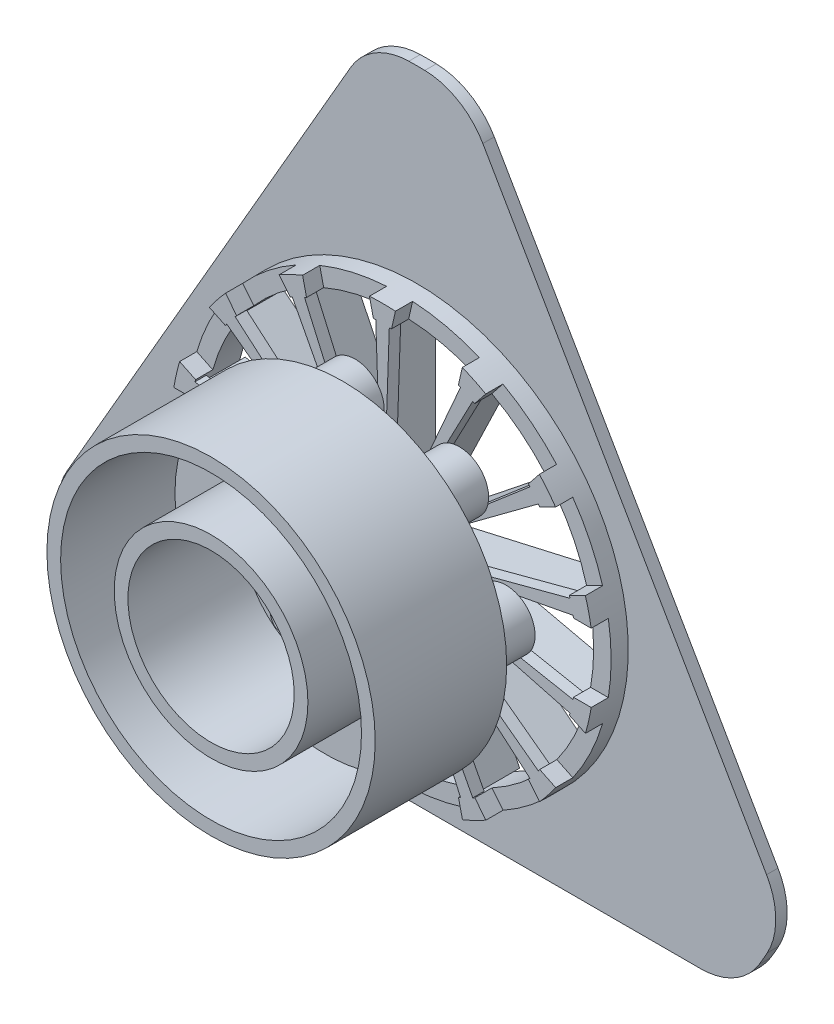
from build123d import *

# Parameters (mm, degrees)
SKETCH2_R               = 18.5
BOSS_EXTRUDE10_DEPTH    = 4
SKETCH8_R               = 22.678479032
SKETCH8_R_2             = 21.249376386
BOSS_EXTRUDE11_DEPTH    = 4
SKETCH9_R               = 1.624259049
SKETCH9_R_2             = 1.124259049
SKETCH9_R_3             = 2.552274029
SKETCH9_R_4             = 2.052274029
BOSS_EXTRUDE12_DEPTH    = 5
BOSS_EXTRUDE16_START    = -1.5
SKETCH11_R              = 14.361292765
SKETCH11_R_2            = 8.114913008
SKETCH11_R_3            = 2.552274029
SKETCH11_R_4            = 4.894571286
SKETCH11_R_5            = 2.052274029
BOSS_EXTRUDE16_DEPTH    = 1.5
SKETCH12_R              = 14.361292765
SKETCH12_R_2            = 13.161292765
SKETCH12_R_3            = 8.473676317
SKETCH12_R_4            = 7.273676317
BOSS_EXTRUDE14_DEPTH    = 10
SKETCH13_R              = 0.9
CUT_EXTRUDE2_DEPTH      = 1.5
BOSS_EXTRUDE17_START    = -3
BOSS_EXTRUDE17_DEPTH    = 1
CUT_EXTRUDE4_START      = -2
SKETCH17_W              = 1.972139385
SKETCH17_H              = 6
CUT_EXTRUDE4_DEPTH      = 5
CIRPATTERN1_COUNT       = 14
CUT_EXTRUDE5_DEPTH      = 34.595041634
CUT_EXTRUDE5_DEPTH_BACK = 34.595041634
SKETCH18_R              = 22.678479032
SKETCH18_R_2            = 21.249376386
SKETCH19_R              = 22.100164657
SKETCH19_R_2            = 18.5
BOSS_EXTRUDE18_DEPTH    = 1
BOSS_EXTRUDE2_START     = -1
SKETCH3_R               = 35
SKETCH3_R_2             = 22.100164657
BOSS_EXTRUDE2_DEPTH     = 1
SKETCH4_R               = 2.9
BOSS_EXTRUDE3_DEPTH     = 2
SKETCH6_R               = 5
BOSS_EXTRUDE4_DEPTH     = 1
SKETCH7_R               = 59.131365533
CUT_EXTRUDE1_DEPTH      = 10
FILLET1_R               = 6
BOSS_EXTRUDE19_START    = -0.5
BOSS_EXTRUDE19_DEPTH    = 0.5


with BuildPart() as part:
    # Sketch2 → Boss-Extrude10 (new body)
    with BuildSketch(Plane.XY.offset(10)):
        Circle(SKETCH2_R)
        with BuildLine():
            Line((-0.15, 16.969746557), (-0.15, 0.683739717))
            ThreePointArc((-0.15, 0.683739717), (-0.155764654, 0.682449539), (-0.161518215, 0.681110759))
            Line((-0.161518215, 0.681110759), (-7.227751758, 15.354295905))
            ThreePointArc((-7.227751758, 15.354295905), (-3.776271369, 16.544925891), (-0.15, 16.969746557))
        make_face(mode=Mode.SUBTRACT)
        with BuildLine():
            Line((-7.498042418, 15.224130783), (-0.431808875, 0.550945638))
            ThreePointArc((-0.431808875, 0.550945638), (-0.436442861, 0.547282038), (-0.441045766, 0.543579463))
            Line((-0.441045766, 0.543579463), (-13.173958637, 10.697738641))
            ThreePointArc((-13.173958637, 10.697738641), (-10.580877249, 13.268000408), (-7.498042418, 15.224130783))
        make_face(mode=Mode.SUBTRACT)
        with BuildLine():
            Line((-13.361005578, 10.463189196), (-0.628092706, 0.309030018))
            ThreePointArc((-0.628092706, 0.309030018), (-0.630678208, 0.303718617), (-0.633218794, 0.298385587))
            Line((-0.633218794, 0.298385587), (-16.510901441, 3.92236304))
            ThreePointArc((-16.510901441, 3.92236304), (-15.289810625, 7.363184723), (-13.361005578, 10.463189196))
        make_face(mode=Mode.SUBTRACT)
        with BuildLine():
            Line((-16.577657721, 3.629884666), (-0.699975074, 0.005907213))
            ThreePointArc((-0.699975074, 0.005907213), (-0.7, 0), (-0.699975074, -0.005907213))
            Line((-0.699975074, -0.005907213), (-16.577657721, -3.629884666))
            ThreePointArc((-16.577657721, -3.629884666), (-16.970409488, 0), (-16.577657721, 3.629884666))
        make_face(mode=Mode.SUBTRACT)
        with BuildLine():
            Line((-16.510901441, -3.92236304), (-0.633218794, -0.298385587))
            ThreePointArc((-0.633218794, -0.298385587), (-0.630678208, -0.303718617), (-0.628092706, -0.309030018))
            Line((-0.628092706, -0.309030018), (-13.361005578, -10.463189196))
            ThreePointArc((-13.361005578, -10.463189196), (-15.289810625, -7.363184723), (-16.510901441, -3.92236304))
        make_face(mode=Mode.SUBTRACT)
        with BuildLine():
            Line((-13.173958637, -10.697738641), (-0.441045766, -0.543579463))
            ThreePointArc((-0.441045766, -0.543579463), (-0.436442861, -0.547282038), (-0.431808875, -0.550945638))
            Line((-0.431808875, -0.550945638), (-7.498042418, -15.224130783))
            ThreePointArc((-7.498042418, -15.224130783), (-10.580877249, -13.268000408), (-13.173958637, -10.697738641))
        make_face(mode=Mode.SUBTRACT)
        with BuildLine():
            Line((-7.227751758, -15.354295905), (-0.161518215, -0.681110759))
            ThreePointArc((-0.161518215, -0.681110759), (-0.155764654, -0.682449539), (-0.15, -0.683739717))
            Line((-0.15, -0.683739717), (-0.15, -16.969746557))
            ThreePointArc((-0.15, -16.969746557), (-3.776271369, -16.544925891), (-7.227751758, -15.354295905))
        make_face(mode=Mode.SUBTRACT)
        with BuildLine():
            Line((0.15, -16.969746557), (0.15, -0.683739717))
            ThreePointArc((0.15, -0.683739717), (0.155764654, -0.682449539), (0.161518215, -0.681110759))
            Line((0.161518215, -0.681110759), (7.227751758, -15.354295905))
            ThreePointArc((7.227751758, -15.354295905), (3.776271369, -16.544925891), (0.15, -16.969746557))
        make_face(mode=Mode.SUBTRACT)
        with BuildLine():
            Line((7.498042418, -15.224130783), (0.431808875, -0.550945638))
            ThreePointArc((0.431808875, -0.550945638), (0.436442861, -0.547282038), (0.441045766, -0.543579463))
            Line((0.441045766, -0.543579463), (13.173958637, -10.697738641))
            ThreePointArc((13.173958637, -10.697738641), (10.580877249, -13.268000408), (7.498042418, -15.224130783))
        make_face(mode=Mode.SUBTRACT)
        with BuildLine():
            Line((13.361005578, -10.463189196), (0.628092706, -0.309030018))
            ThreePointArc((0.628092706, -0.309030018), (0.630678208, -0.303718617), (0.633218794, -0.298385587))
            Line((0.633218794, -0.298385587), (16.510901441, -3.92236304))
            ThreePointArc((16.510901441, -3.92236304), (15.289810625, -7.363184723), (13.361005578, -10.463189196))
        make_face(mode=Mode.SUBTRACT)
        with BuildLine():
            Line((16.577657721, -3.629884666), (0.699975074, -0.005907213))
            ThreePointArc((0.699975074, -0.005907213), (0.7, 0), (0.699975074, 0.005907213))
            Line((0.699975074, 0.005907213), (16.577657721, 3.629884666))
            ThreePointArc((16.577657721, 3.629884666), (16.970409488, 0), (16.577657721, -3.629884666))
        make_face(mode=Mode.SUBTRACT)
        with BuildLine():
            Line((16.510901441, 3.92236304), (0.633218794, 0.298385587))
            ThreePointArc((0.633218794, 0.298385587), (0.630678208, 0.303718617), (0.628092706, 0.309030018))
            Line((0.628092706, 0.309030018), (13.361005578, 10.463189196))
            ThreePointArc((13.361005578, 10.463189196), (15.289810625, 7.363184723), (16.510901441, 3.92236304))
        make_face(mode=Mode.SUBTRACT)
        with BuildLine():
            Line((13.173958637, 10.697738641), (0.441045766, 0.543579463))
            ThreePointArc((0.441045766, 0.543579463), (0.436442861, 0.547282038), (0.431808875, 0.550945638))
            Line((0.431808875, 0.550945638), (7.498042418, 15.224130783))
            ThreePointArc((7.498042418, 15.224130783), (10.580877249, 13.268000408), (13.173958637, 10.697738641))
        make_face(mode=Mode.SUBTRACT)
        with BuildLine():
            Line((7.227751758, 15.354295905), (0.161518215, 0.681110759))
            ThreePointArc((0.161518215, 0.681110759), (0.155764654, 0.682449539), (0.15, 0.683739717))
            Line((0.15, 0.683739717), (0.15, 16.969746557))
            ThreePointArc((0.15, 16.969746557), (3.776271369, 16.544925891), (7.227751758, 15.354295905))
        make_face(mode=Mode.SUBTRACT)
    extrude(amount=BOSS_EXTRUDE10_DEPTH)

    # Sketch9 → Boss-Extrude12 (add)
    # profile 1 of 14: a face of its own
    with BuildSketch(Plane.XY.offset(14)):
        with Locations(Location((1.474259049, 6.459150925, 0), (0, 0, 180))):
            Circle(SKETCH9_R)
        with Locations((1.474259049, 6.459150925)):
            Circle(SKETCH9_R_2, mode=Mode.SUBTRACT)
    # profile 2 of 14: a face of its own
    with BuildSketch(Plane.XY.offset(14)):
        with Locations(Location((6.731022253, 8.440434938, 0), (0, 0, 182.345436186))):
            Circle(SKETCH9_R_3)
        with Locations((6.731022253, 8.440434938)):
            Circle(SKETCH9_R_4, mode=Mode.SUBTRACT)
    # profile 3 of 14: a face of its own
    with BuildSketch(Plane.XY.offset(14)):
        with Locations((-2.402274029, 10.525050214)):
            Circle(SKETCH9_R_3)
        with Locations((-2.402274029, 10.525050214)):
            Circle(SKETCH9_R_4, mode=Mode.SUBTRACT)
    # profile 4 of 14: a face of its own
    with BuildSketch(Plane.XY.offset(14)):
        with Locations(Location((-4.130782061, 5.179836868, 0), (0, 0, 196.045646816))):
            Circle(SKETCH9_R)
        with Locations((-4.130782061, 5.179836868)):
            Circle(SKETCH9_R_2, mode=Mode.SUBTRACT)
    # profile 5 of 14: a face of its own
    with BuildSketch(Plane.XY.offset(14)):
        with Locations(Location((-9.72660897, 4.684088007, 0), (0, 0, 229.083135243))):
            Circle(SKETCH9_R_3)
        with Locations((-9.72660897, 4.684088007)):
            Circle(SKETCH9_R_4, mode=Mode.SUBTRACT)
    # profile 6 of 14: a face of its own
    with BuildSketch(Plane.XY.offset(14)):
        with Locations(Location((-6.625260026, 0, 0), (0, 0, 112.525781755))):
            Circle(SKETCH9_R)
        with Locations((-6.625260026, 0)):
            Circle(SKETCH9_R_2, mode=Mode.SUBTRACT)
    # profile 7 of 14: a face of its own
    with BuildSketch(Plane.XY.offset(14)):
        with Locations(Location((-9.72660897, -4.684088007, 0), (0, 0, 130.916864757))):
            Circle(SKETCH9_R_3)
        with Locations((-9.72660897, -4.684088007)):
            Circle(SKETCH9_R_4, mode=Mode.SUBTRACT)
    # profile 8 of 14: a face of its own
    with BuildSketch(Plane.XY.offset(14)):
        with Locations(Location((-4.130782061, -5.179836868, 0), (0, 0, 163.954353184))):
            Circle(SKETCH9_R)
        with Locations((-4.130782061, -5.179836868)):
            Circle(SKETCH9_R_2, mode=Mode.SUBTRACT)
    # profile 9 of 14: a face of its own
    with BuildSketch(Plane.XY.offset(14)):
        with Locations((-2.402274029, -10.525050214)):
            Circle(SKETCH9_R_3)
        with Locations((-2.402274029, -10.525050214)):
            Circle(SKETCH9_R_4, mode=Mode.SUBTRACT)
    # profile 10 of 14: a face of its own
    with BuildSketch(Plane.XY.offset(14)):
        with Locations(Location((6.731022253, -8.440434938, 0), (0, 0, 177.654563814))):
            Circle(SKETCH9_R_3)
        with Locations((6.731022253, -8.440434938)):
            Circle(SKETCH9_R_4, mode=Mode.SUBTRACT)
    # profile 11 of 14: a face of its own
    with BuildSketch(Plane.XY.offset(14)):
        with Locations(Location((5.969153026, -2.874592593, 0), (0, 0, 196.045646816))):
            Circle(SKETCH9_R)
        with Locations((5.969153026, -2.874592593)):
            Circle(SKETCH9_R_2, mode=Mode.SUBTRACT)
    # profile 12 of 14: a face of its own
    with BuildSketch(Plane.XY.offset(14)):
        with Locations(Location((1.474259049, -6.459150925, 0), (0, 0, 180))):
            Circle(SKETCH9_R)
        with Locations((1.474259049, -6.459150925)):
            Circle(SKETCH9_R_2, mode=Mode.SUBTRACT)
    # profile 13 of 14: a face of its own
    with BuildSketch(Plane.XY.offset(14)):
        with Locations(Location((5.969153026, 2.874592593, 0), (0, 0, 163.954353184))):
            Circle(SKETCH9_R)
        with Locations((5.969153026, 2.874592593)):
            Circle(SKETCH9_R_2, mode=Mode.SUBTRACT)
    # profile 14 of 14: a face of its own
    with BuildSketch(Plane.XY.offset(14)):
        with Locations(Location((10.795721491, 0, 0), (0, 0, 229.083135243))):
            Circle(SKETCH9_R_3)
        with Locations((10.795721491, 0)):
            Circle(SKETCH9_R_4, mode=Mode.SUBTRACT)
    extrude(amount=BOSS_EXTRUDE12_DEPTH)

    # Sketch11 → Boss-Extrude16 (add)
    # profile 1 of 4: a face of its own
    with BuildSketch(Plane.XY.offset(19).offset(BOSS_EXTRUDE16_START)):
        Circle(SKETCH11_R)
        Circle(SKETCH11_R_2, mode=Mode.SUBTRACT)
        with Locations(Location((10.795721491, 0, 0), (0, 0, 229.083135243))):
            Circle(SKETCH11_R_3, mode=Mode.SUBTRACT)
    # profile 2 of 4: a face of its own
    with BuildSketch(Plane.XY.offset(19).offset(BOSS_EXTRUDE16_START)):
        Circle(SKETCH11_R_2)
        Circle(SKETCH11_R_4, mode=Mode.SUBTRACT)
    # profile 3 of 4: a face of its own
    with BuildSketch(Plane.XY.offset(19).offset(BOSS_EXTRUDE16_START)):
        Circle(SKETCH11_R_4)
    # profile 4 of 4: a face of its own
    with BuildSketch(Plane.XY.offset(19).offset(BOSS_EXTRUDE16_START)):
        with Locations((10.795721491, 0)):
            Circle(SKETCH11_R_5)
    extrude(amount=BOSS_EXTRUDE16_DEPTH)

    # Sketch12 → Boss-Extrude14 (add)
    # profile 1 of 2: a face of its own
    with BuildSketch(Plane.XY.offset(19)):
        Circle(SKETCH12_R)
        Circle(SKETCH12_R_2, mode=Mode.SUBTRACT)
    # profile 2 of 2: a face of its own
    with BuildSketch(Plane.XY.offset(19)):
        Circle(SKETCH12_R_3)
        Circle(SKETCH12_R_4, mode=Mode.SUBTRACT)
    extrude(amount=BOSS_EXTRUDE14_DEPTH)

    # Sketch13 → Cut-Extrude2 (cut)
    with BuildSketch(Plane.XY.offset(19)):
        with Locations((1.355008269, 6.147508162)):
            Circle(SKETCH13_R)
        with Locations((5.651149256, 2.773520522)):
            Circle(SKETCH13_R)
        with Locations((5.691859592, -2.68898464)):
            Circle(SKETCH13_R)
        with Locations((1.446483562, -6.126629523)):
            Circle(SKETCH13_R)
        with Locations((-3.888124093, -4.950797415)):
            Circle(SKETCH13_R)
        with Locations((-6.294895003, -0.046913875)):
            Circle(SKETCH13_R)
        with Locations((-3.961481583, 4.892296769)):
            Circle(SKETCH13_R)
        with Locations((-2.402274029, 10.525050214)):
            Circle(SKETCH13_R)
        with Locations((6.819905417, 8.551890899)):
            Circle(SKETCH13_R)
        with Locations((11.02716218, 0.111455962)):
            Circle(SKETCH13_R)
        with Locations((7.051346107, -8.440434938)):
            Circle(SKETCH13_R)
        with Locations((-2.113672209, -10.664033525)):
            Circle(SKETCH13_R)
        with Locations((-9.566447043, -4.884924711)):
            Circle(SKETCH13_R)
        with Locations((-9.694886936, 4.545104696)):
            Circle(SKETCH13_R)
    extrude(amount=-CUT_EXTRUDE2_DEPTH, mode=Mode.SUBTRACT)

    # Sketch16 → Boss-Extrude17 (add)
    with BuildSketch(Plane(origin=(0, 0, 10), x_dir=(-1, 0, 0), z_dir=(0, 0, -1)).offset(BOSS_EXTRUDE17_START)):
        with BuildLine():
            ThreePointArc((-7.892305965, 15.023525044), (-7.363184723, 15.289810625), (-6.825092574, 15.537467926))
            Line((-6.825092574, 15.537467926), (0, 0))
            Line((0, 0), (-7.892305965, 15.023525044))
        make_face()
        with BuildLine():
            ThreePointArc((-0.59225875, 16.960071573), (0, 16.970409488), (0.59225875, 16.960071573))
            Line((0.59225875, 16.960071573), (0, 0))
            Line((0, 0), (-0.59225875, 16.960071573))
        make_face()
        with BuildLine():
            ThreePointArc((6.825092574, 15.537467926), (7.363184723, 15.289810625), (7.892305965, 15.023525044))
            Line((7.892305965, 15.023525044), (0, 0))
            Line((0, 0), (6.825092574, 15.537467926))
        make_face()
        with BuildLine():
            ThreePointArc((12.89065061, 11.037478201), (13.268000408, 10.580877249), (13.629185192, 10.111385128))
            Line((13.629185192, 10.111385128), (0, 0))
            Line((0, 0), (12.89065061, 11.037478201))
        make_face()
        with BuildLine():
            ThreePointArc((16.403057199, 4.351380553), (16.544925891, 3.776271369), (16.66663714, 3.19656138))
            Line((16.66663714, 3.19656138), (0, 0))
            Line((0, 0), (16.403057199, 4.351380553))
        make_face()
        with BuildLine():
            ThreePointArc((16.66663714, -3.19656138), (16.544925891, -3.776271369), (16.403057199, -4.351380553))
            Line((16.403057199, -4.351380553), (0, 0))
            Line((0, 0), (16.66663714, -3.19656138))
        make_face()
        with BuildLine():
            ThreePointArc((13.629185192, -10.111385128), (13.268000408, -10.580877249), (12.89065061, -11.037478201))
            Line((12.89065061, -11.037478201), (0, 0))
            Line((0, 0), (13.629185192, -10.111385128))
        make_face()
        with BuildLine():
            ThreePointArc((7.892305965, -15.023525044), (7.363184723, -15.289810625), (6.825092574, -15.537467926))
            Line((6.825092574, -15.537467926), (0, 0))
            Line((0, 0), (7.892305965, -15.023525044))
        make_face()
        with BuildLine():
            ThreePointArc((0.59225875, -16.960071573), (0, -16.970409488), (-0.59225875, -16.960071573))
            Line((-0.59225875, -16.960071573), (0, 0))
            Line((0, 0), (0.59225875, -16.960071573))
        make_face()
        with BuildLine():
            ThreePointArc((-6.825092574, -15.537467926), (-7.363184723, -15.289810625), (-7.892305965, -15.023525044))
            Line((-7.892305965, -15.023525044), (0, 0))
            Line((0, 0), (-6.825092574, -15.537467926))
        make_face()
        with BuildLine():
            ThreePointArc((-16.403057199, -4.351380553), (-16.544925891, -3.776271369), (-16.66663714, -3.19656138))
            Line((-16.66663714, -3.19656138), (0, 0))
            Line((0, 0), (-16.403057199, -4.351380553))
        make_face()
        with BuildLine():
            ThreePointArc((-12.89065061, -11.037478201), (-13.268000408, -10.580877249), (-13.629185192, -10.111385128))
            Line((-13.629185192, -10.111385128), (0, 0))
            Line((0, 0), (-12.89065061, -11.037478201))
        make_face()
        with BuildLine():
            ThreePointArc((-16.66663714, 3.19656138), (-16.544925891, 3.776271369), (-16.403057199, 4.351380553))
            Line((-16.403057199, 4.351380553), (0, 0))
            Line((0, 0), (-16.66663714, 3.19656138))
        make_face()
        with BuildLine():
            ThreePointArc((-13.629185192, 10.111385128), (-13.268000408, 10.580877249), (-12.89065061, 11.037478201))
            Line((-12.89065061, 11.037478201), (0, 0))
            Line((0, 0), (-13.629185192, 10.111385128))
        make_face()
    extrude(amount=-BOSS_EXTRUDE17_DEPTH)

    # Sketch17 → Cut-Extrude4 (cut)
    with BuildSketch(Plane(origin=(22.678479032, 0, 0), x_dir=(0, 0, -1), z_dir=(1, 0, 0)).offset(CUT_EXTRUDE4_START)):
        with Locations((-13.486069692, 0.005907213)):
            Rectangle(SKETCH17_W, SKETCH17_H)
    cut_extrude4 = extrude(amount=-CUT_EXTRUDE4_DEPTH, mode=Mode.SUBTRACT)

    # CirPattern1: Cut-Extrude4 ×14 about axis
    cirpattern1_axis = Axis((0, 0, 0), (0, 0, 1))
    for i in range(1, CIRPATTERN1_COUNT):
        add(cut_extrude4.rotate(cirpattern1_axis, i * 360 / CIRPATTERN1_COUNT), mode=Mode.SUBTRACT)

    # Sketch19 → Boss-Extrude18 (add)
    with BuildSketch(Plane(origin=(0, 0, 10), x_dir=(-1, 0, 0), z_dir=(0, 0, -1))):
        Circle(SKETCH19_R)
        Circle(SKETCH19_R_2, mode=Mode.SUBTRACT)
    extrude(amount=-BOSS_EXTRUDE18_DEPTH)

    # Sketch3 → Boss-Extrude2 (add)
    with BuildSketch(Plane.XY.offset(11).offset(BOSS_EXTRUDE2_START)):
        Circle(SKETCH3_R)
        Circle(SKETCH3_R_2, mode=Mode.SUBTRACT)
    extrude(amount=BOSS_EXTRUDE2_DEPTH)

    # Sketch4 → Boss-Extrude3 (add)
    with BuildSketch(Plane(origin=(0, 0, 10), x_dir=(-1, 0, 0), z_dir=(0, 0, -1))):
        with Locations(Location((0, 29, 0), (0, 0, 180))):
            Circle(SKETCH4_R)
        with Locations(Location((25.11473671, -14.5, 0), (0, 0, 180))):
            Circle(SKETCH4_R)
        with Locations(Location((-25.11473671, -14.5, 0), (0, 0, 180))):
            Circle(SKETCH4_R)
    extrude(amount=BOSS_EXTRUDE3_DEPTH)

    # Sketch6 → Boss-Extrude4 (add)
    with BuildSketch(Plane.XY.offset(10)):
        with Locations((0, 30)):
            Circle(SKETCH6_R)
        with Locations((25.980762114, -15)):
            Circle(SKETCH6_R)
        with Locations((-25.980762114, -15)):
            Circle(SKETCH6_R)
    extrude(amount=BOSS_EXTRUDE4_DEPTH)

    # Sketch7 → Cut-Extrude1 (cut)
    with BuildSketch(Plane(origin=(0, 0, 8), x_dir=(-1, 0, 0), z_dir=(0, 0, -1))):
        Circle(SKETCH7_R)
        Polygon((0, 42), (-36.373066959, -21), (36.373066959, -21), align=None, mode=Mode.SUBTRACT)
    extrude(amount=-CUT_EXTRUDE1_DEPTH, mode=Mode.SUBTRACT)

    # Fillet1
    fillet1_edges = [part.edges().sort_by_distance(p)[0] for p in [
        (32.186533479, -13.748711306, 10.5),
        (4.186533479, 34.748711306, 10.5),
        (-28, -21, 10.5),
        (28, -21, 10.5),
        (-4.186533479, 34.748711306, 10.5),
        (-32.186533479, -13.748711306, 10.5),
    ]]
    fillet(fillet1_edges, radius=FILLET1_R)

    # Sketch20 → Boss-Extrude19 (add)
    with BuildSketch(Plane.XY.offset(10).offset(BOSS_EXTRUDE19_START)):
        with BuildLine():
            ThreePointArc((0.15, 16.969746557), (0, 16.970409488), (-0.15, 16.969746557))
            Line((-0.15, 16.969746557), (-0.15, 0.683739717))
            ThreePointArc((-0.15, 0.683739717), (0, 0.7), (0.15, 0.683739717))
            Line((0.15, 0.683739717), (0.15, 16.969746557))
        make_face()
        with BuildLine():
            Line((-0.161518215, 0.681110759), (-7.227751758, 15.354295905))
            ThreePointArc((-7.227751758, 15.354295905), (-7.363184723, 15.289810625), (-7.498042418, 15.224130783))
            Line((-7.498042418, 15.224130783), (-0.431808875, 0.550945638))
            ThreePointArc((-0.431808875, 0.550945638), (-0.303718617, 0.630678208), (-0.161518215, 0.681110759))
        make_face()
        with BuildLine():
            ThreePointArc((7.498042418, 15.224130783), (7.363184723, 15.289810625), (7.227751758, 15.354295905))
            Line((7.227751758, 15.354295905), (0.161518215, 0.681110759))
            ThreePointArc((0.161518215, 0.681110759), (0.303718617, 0.630678208), (0.431808875, 0.550945638))
            Line((0.431808875, 0.550945638), (7.498042418, 15.224130783))
        make_face()
        with BuildLine():
            Line((-0.441045766, 0.543579463), (-13.173958637, 10.697738641))
            ThreePointArc((-13.173958637, 10.697738641), (-13.268000408, 10.580877249), (-13.361005578, 10.463189196))
            Line((-13.361005578, 10.463189196), (-0.628092706, 0.309030018))
            ThreePointArc((-0.628092706, 0.309030018), (-0.547282038, 0.436442861), (-0.441045766, 0.543579463))
        make_face()
        with BuildLine():
            ThreePointArc((13.361005578, 10.463189196), (13.268000408, 10.580877249), (13.173958637, 10.697738641))
            Line((13.173958637, 10.697738641), (0.441045766, 0.543579463))
            ThreePointArc((0.441045766, 0.543579463), (0.547282038, 0.436442861), (0.628092706, 0.309030018))
            Line((0.628092706, 0.309030018), (13.361005578, 10.463189196))
        make_face()
        with BuildLine():
            Line((-0.633218794, 0.298385587), (-16.510901441, 3.92236304))
            ThreePointArc((-16.510901441, 3.92236304), (-16.544925891, 3.776271369), (-16.577657721, 3.629884666))
            Line((-16.577657721, 3.629884666), (-0.699975074, 0.005907213))
            ThreePointArc((-0.699975074, 0.005907213), (-0.682449539, 0.155764654), (-0.633218794, 0.298385587))
        make_face()
        with BuildLine():
            ThreePointArc((16.577657721, 3.629884666), (16.544925891, 3.776271369), (16.510901441, 3.92236304))
            Line((16.510901441, 3.92236304), (0.633218794, 0.298385587))
            ThreePointArc((0.633218794, 0.298385587), (0.682449539, 0.155764654), (0.699975074, 0.005907213))
            Line((0.699975074, 0.005907213), (16.577657721, 3.629884666))
        make_face()
        with BuildLine():
            Line((-0.699975074, -0.005907213), (-16.577657721, -3.629884666))
            ThreePointArc((-16.577657721, -3.629884666), (-16.544925891, -3.776271369), (-16.510901441, -3.92236304))
            Line((-16.510901441, -3.92236304), (-0.633218794, -0.298385587))
            ThreePointArc((-0.633218794, -0.298385587), (-0.682449539, -0.155764654), (-0.699975074, -0.005907213))
        make_face()
        with BuildLine():
            ThreePointArc((16.510901441, -3.92236304), (16.544925891, -3.776271369), (16.577657721, -3.629884666))
            Line((16.577657721, -3.629884666), (0.699975074, -0.005907213))
            ThreePointArc((0.699975074, -0.005907213), (0.682449539, -0.155764654), (0.633218794, -0.298385587))
            Line((0.633218794, -0.298385587), (16.510901441, -3.92236304))
        make_face()
        with BuildLine():
            Line((-0.628092706, -0.309030018), (-13.361005578, -10.463189196))
            ThreePointArc((-13.361005578, -10.463189196), (-13.268000408, -10.580877249), (-13.173958637, -10.697738641))
            Line((-13.173958637, -10.697738641), (-0.441045766, -0.543579463))
            ThreePointArc((-0.441045766, -0.543579463), (-0.547282038, -0.436442861), (-0.628092706, -0.309030018))
        make_face()
        with BuildLine():
            ThreePointArc((13.173958637, -10.697738641), (13.268000408, -10.580877249), (13.361005578, -10.463189196))
            Line((13.361005578, -10.463189196), (0.628092706, -0.309030018))
            ThreePointArc((0.628092706, -0.309030018), (0.547282038, -0.436442861), (0.441045766, -0.543579463))
            Line((0.441045766, -0.543579463), (13.173958637, -10.697738641))
        make_face()
        with BuildLine():
            Line((-0.431808875, -0.550945638), (-7.498042418, -15.224130783))
            ThreePointArc((-7.498042418, -15.224130783), (-7.363184723, -15.289810625), (-7.227751758, -15.354295905))
            Line((-7.227751758, -15.354295905), (-0.161518215, -0.681110759))
            ThreePointArc((-0.161518215, -0.681110759), (-0.303718617, -0.630678208), (-0.431808875, -0.550945638))
        make_face()
        with BuildLine():
            ThreePointArc((7.227751758, -15.354295905), (7.363184723, -15.289810625), (7.498042418, -15.224130783))
            Line((7.498042418, -15.224130783), (0.431808875, -0.550945638))
            ThreePointArc((0.431808875, -0.550945638), (0.303718617, -0.630678208), (0.161518215, -0.681110759))
            Line((0.161518215, -0.681110759), (7.227751758, -15.354295905))
        make_face()
        with BuildLine():
            Line((-0.15, -0.683739717), (-0.15, -16.969746557))
            ThreePointArc((-0.15, -16.969746557), (0, -16.970409488), (0.15, -16.969746557))
            Line((0.15, -16.969746557), (0.15, -0.683739717))
            ThreePointArc((0.15, -0.683739717), (0, -0.7), (-0.15, -0.683739717))
        make_face()
    extrude(amount=BOSS_EXTRUDE19_DEPTH)


with BuildPart() as body_2:
    # Sketch8 → Boss-Extrude11 (new body)
    with BuildSketch(Plane.XY.offset(14)):
        Circle(SKETCH8_R)
        Circle(SKETCH8_R_2, mode=Mode.SUBTRACT)
    extrude(amount=-BOSS_EXTRUDE11_DEPTH)

    # Sketch18 → Cut-Extrude5 (cut, two sides: drawn at the far end of the back side and taken through both)
    with BuildSketch(Plane.XY.offset(19).offset(-CUT_EXTRUDE5_DEPTH_BACK)):
        Circle(SKETCH18_R)
        Circle(SKETCH18_R_2, mode=Mode.SUBTRACT)
    extrude(amount=CUT_EXTRUDE5_DEPTH + CUT_EXTRUDE5_DEPTH_BACK, mode=Mode.SUBTRACT)


solid = part.part
